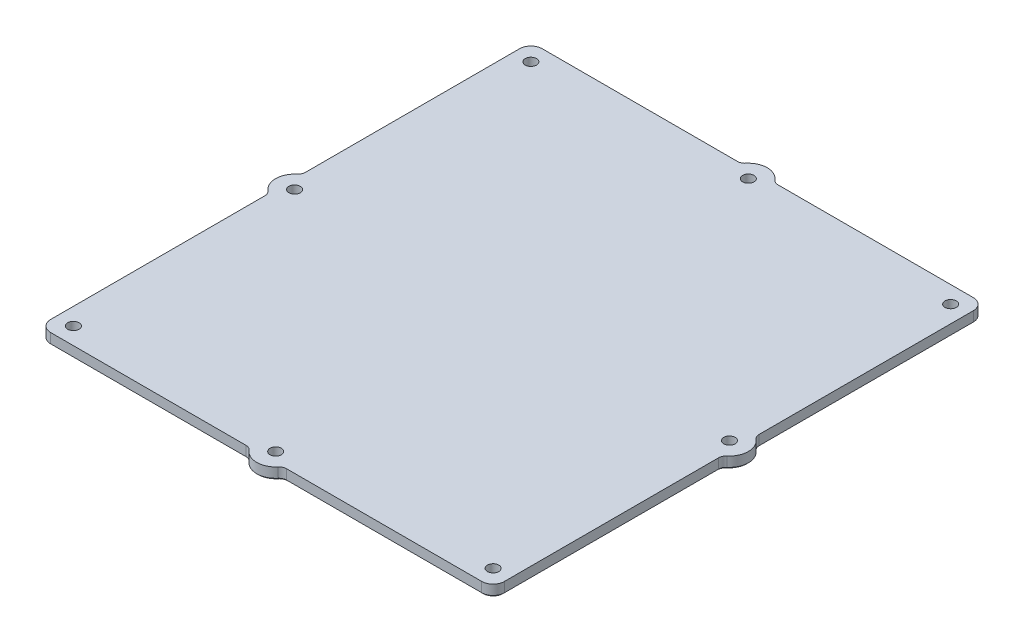
from build123d import *

# Parameters (mm, degrees)
SKETCH_1_W              = 120
SKETCH_1_H              = 130
EXTRUDE_1_DEPTH         = 3
SKETCH_2_R              = 1.5
CUT_EXTRUDE_1_DEPTH     = 3
FILLET_1_R              = 3
SKETCH_4_R              = 1.5
CUT_EXTRUDE_3_DEPTH     = 177.943493805
EXTRUDE_2_DEPTH         = 3
FILLET_2_R              = 2
CHAMFER_1_SIZE          = 0.4
CUT_EXTRUDE_START       = -0.4
CUT_EXTRUDE_4_OUTLINE_W = 2.081871345
CUT_EXTRUDE_4_OUTLINE_H = 12.109161793
CUT_EXTRUDE_4_DEPTH     = 0.4


# Read off the part's stored shape, not the designer's step: 切除-拉伸4
with BuildPart() as part:
    # 草图1 → 凸台-拉伸1 (new body)
    with BuildSketch(Plane(origin=(0, 0, 0), x_dir=(1, 0, 0), z_dir=(0, 1, 0))):
        with Locations((60, 65)):
            Rectangle(SKETCH_1_W, SKETCH_1_H)
    extrude(amount=EXTRUDE_1_DEPTH)

    # 草图2 → 切除-拉伸1 (cut)
    with BuildSketch(Plane(origin=(0, 3, 0), x_dir=(1, 0, 0), z_dir=(0, 1, 0))):
        with Locations(Location((4.5, 125.5, 0), (0, 0, 270))):
            Circle(SKETCH_2_R)
        with Locations(Location((115.5, 125.5, 0), (0, 0, 270))):
            Circle(SKETCH_2_R)
        with Locations(Location((115.5, 4.5, 0), (0, 0, 270))):
            Circle(SKETCH_2_R)
        with Locations(Location((4.5, 4.5, 0), (0, 0, 270))):
            Circle(SKETCH_2_R)
    extrude(amount=-CUT_EXTRUDE_1_DEPTH, mode=Mode.SUBTRACT)

    # 圆角1
    fillet_1_edges = [part.edges().sort_by_distance(p)[0] for p in [
        (0, 1.5, -130),
        (120, 1.5, -130),
        (120, 1.5, 0),
        (0, 1.5, 0),
    ]]
    fillet(fillet_1_edges, radius=FILLET_1_R)

    # 草图4 → 切除-拉伸3 (cut, through all)
    with BuildSketch(Plane(origin=(0, 0, 0), x_dir=(-1, 0, 0), z_dir=(0, -1, 0))):
        with Locations(Location((-117.5, 65, 0), (0, 0, 90))):
            Circle(SKETCH_4_R)
        with Locations(Location((-60, 127.5, 0), (0, 0, 90))):
            Circle(SKETCH_4_R)
        with Locations(Location((-2.5, 65, 0), (0, 0, 90))):
            Circle(SKETCH_4_R)
        with Locations(Location((-60, 2.5, 0), (0, 0, 90))):
            Circle(SKETCH_4_R)
    extrude(amount=-CUT_EXTRUDE_3_DEPTH, mode=Mode.SUBTRACT)

    # 草图6 → 凸台-拉伸2 (add)
    with BuildSketch(Plane(origin=(0, 0, 0), x_dir=(-1, 0, 0), z_dir=(0, -1, 0))):
        with BuildLine():
            Line((-55.669872981, 0), (-64.330127019, 0))
            ThreePointArc((-64.330127019, 0), (-60, -2.5), (-55.669872981, 0))
        make_face()
        with BuildLine():
            Line((0, 60.669872981), (0, 69.330127019))
            ThreePointArc((0, 69.330127019), (2.5, 65), (0, 60.669872981))
        make_face()
        with BuildLine():
            Line((-55.669872981, 130), (-64.330127019, 130))
            ThreePointArc((-64.330127019, 130), (-60, 132.5), (-55.669872981, 130))
        make_face()
        with BuildLine():
            Line((-120, 60.669872981), (-120, 69.330127019))
            ThreePointArc((-120, 69.330127019), (-122.5, 65), (-120, 60.669872981))
        make_face()
    extrude(amount=-EXTRUDE_2_DEPTH)

    # 圆角2
    fillet_2_edges = [part.edges().sort_by_distance(p)[0] for p in [
        (120, 1.5, -60.669872981),
        (120, 1.5, -69.330127019),
        (55.669872981, 1.5, 0),
        (64.330127019, 1.5, 0),
        (64.330127019, 1.5, -130),
        (55.669872981, 1.5, -130),
        (0, 1.5, -69.330127019),
        (0, 1.5, -60.669872981),
    ]]
    fillet(fillet_2_edges, radius=FILLET_2_R)

    # 倒角1
    chamfer_1_edges = [part.edges().sort_by_distance(p)[0] for p in [
        (120, 0, -98.680951324),
        (122.5, 0, -65),
        (91.180951324, 0, 0),
        (60, 0, 2.5),
        (-2.5, 0, -65),
        (28.819048676, 0, -130),
        (60, 0, -132.5),
        (0, 0, -31.319048676),
        (120.187346066, 0, -69.516748393),
        (120.187346066, 0, -60.483251607),
        (64.516748393, 0, 0.187346066),
        (55.483251607, 0, 0.187346066),
        (-0.187346066, 0, -69.516748393),
        (55.483251607, 0, -130.187346066),
        (64.516748393, 0, -130.187346066),
        (-0.187346066, 0, -60.483251607),
        (4.5, 0, -6),
        (115.5, 0, -6),
        (115.5, 0, -127),
        (4.5, 0, -127),
        (0, 0, -98.680951324),
        (91.180951324, 0, -130),
        (120, 0, -31.319048676),
        (28.819048676, 0, 0),
        (0.878679656, 0, -0.878679656),
        (119.121320344, 0, -0.878679656),
        (119.121320344, 0, -129.121320344),
        (0.878679656, 0, -129.121320344),
        (117.5, 0, -63.5),
        (60, 0, -126),
        (2.5, 0, -63.5),
        (60, 0, -1),
    ]]
    chamfer(chamfer_1_edges, length=CHAMFER_1_SIZE)

    # 切除-拉伸4 outline → 切除-拉伸4 (cut)
    # profile 1 of 9: a face of its own
    with BuildSketch(Plane(origin=(0, 0, 0), x_dir=(-1, 0, 0), z_dir=(0, -1, 0)).offset(CUT_EXTRUDE_START)):
        with BuildLine():
            add(Edge.make_bspline(
                [(-93.842597619, 70.642021665), (-93.621504559, 70.63755981), (-93.192959468, 70.628911388), (-92.572802476, 70.561692302), (-91.998556709, 70.448204443), (-91.470334132, 70.290461994), (-90.987295697, 70.087463663), (-90.549684034, 69.83753463), (-90.159300203, 69.539039504), (-89.814297782, 69.193703423), (-89.511835456, 68.7993463), (-89.255278497, 68.349235957), (-89.034115776, 67.848793836), (-88.854987072, 67.292990542), (-88.719890276, 66.683553056), (-88.622348209, 66.020814756), (-88.562292192, 65.304592968), (-88.5547524, 64.808918818), (-88.55084973, 64.552353049)],
                knots=[0, 0, 0, 0, 0.071201178, 0.138009377, 0.200615386, 0.259496855, 0.315264295, 0.369016079, 0.421367624, 0.473064341, 0.525807093, 0.580944039, 0.639536507, 0.701748872, 0.768699696, 0.840366328, 0.917372057, 1, 1, 1, 1], degree=3))
            Line((-93.842597619, 70.642021665), (-96.350719776, 70.642021665))
            Line((-96.350719776, 70.642021665), (-96.350719776, 58.532859872))
            Line((-96.350719776, 58.532859872), (-93.842597619, 58.532859872))
            add(Edge.make_bspline(
                [(-88.55084973, 64.552353049), (-88.555570498, 64.29578876), (-88.564693164, 63.799989997), (-88.627829381, 63.083814876), (-88.740073451, 62.423746086), (-88.890415923, 61.81693293), (-89.090708302, 61.265346897), (-89.334761121, 60.76876052), (-89.621770574, 60.325577948), (-89.957274109, 59.940996965), (-90.333787716, 59.610966979), (-90.736796903, 59.319357305), (-91.175990614, 59.077430131), (-91.645251045, 58.875071981), (-92.150072931, 58.724281219), (-92.685235098, 58.61098466), (-93.253658531, 58.54705882), (-93.643180915, 58.537667682), (-93.842597619, 58.532859872)],
                knots=[0, 0, 0, 0, 0.083884036, 0.162102066, 0.234794836, 0.302603191, 0.366226687, 0.426272698, 0.483153898, 0.538366567, 0.592541318, 0.646543992, 0.700689114, 0.756145388, 0.813312224, 0.87264444, 0.934800086, 1, 1, 1, 1], degree=3))
        make_face()
        with BuildLine():
            add(Edge.make_bspline(
                [(-93.842597619, 60.172885863), (-93.71509612, 60.175834067), (-93.467954965, 60.181548687), (-93.10966435, 60.226901781), (-92.775425943, 60.29757872), (-92.467082035, 60.402363426), (-92.182705821, 60.53512808), (-91.924140853, 60.7004657), (-91.688603192, 60.893385854), (-91.476444353, 61.118335282), (-91.288450659, 61.382730215), (-91.131259096, 61.695355757), (-91.000378403, 62.055534905), (-90.888432626, 62.461994563), (-90.804571318, 62.917731967), (-90.746734239, 63.420522825), (-90.710058234, 63.970483396), (-90.705349837, 64.353027415), (-90.702896514, 64.552353049)],
                knots=[0, 0, 0, 0, 0.06157925, 0.119361476, 0.17420375, 0.226354123, 0.276345084, 0.325461037, 0.374229775, 0.423086444, 0.474419126, 0.530390201, 0.591577019, 0.659307146, 0.733845725, 0.815199008, 0.903708925, 1, 1, 1, 1], degree=3))
            Line((-93.842597619, 60.172885863), (-94.268848431, 60.172885863))
            Line((-94.268848431, 60.172885863), (-94.268848431, 69.001995674))
            Line((-94.268848431, 69.001995674), (-93.842597619, 69.001995674))
            add(Edge.make_bspline(
                [(-90.702896514, 64.552353049), (-90.705347471, 64.752545717), (-90.710052163, 65.136822052), (-90.746777665, 65.689364788), (-90.804472492, 66.19478917), (-90.888974246, 66.653794512), (-91.00018179, 67.065938032), (-91.133778496, 67.431501716), (-91.291688296, 67.750720834), (-91.478764144, 68.02259829), (-91.690985772, 68.254183254), (-91.923256484, 68.457026582), (-92.183203957, 68.626981349), (-92.468281661, 68.764663227), (-92.777147992, 68.871639864), (-93.11031926, 68.945644269), (-93.467784438, 68.993987446), (-93.715075462, 68.999271046), (-93.842597619, 69.001995674)],
                knots=[0, 0, 0, 0, 0.095937682, 0.184155499, 0.265271805, 0.339623548, 0.407614047, 0.469624787, 0.525889424, 0.577833102, 0.627214304, 0.676079586, 0.725254369, 0.775579675, 0.82744862, 0.881538554, 0.938912222, 1, 1, 1, 1], degree=3))
        make_face(mode=Mode.SUBTRACT)
    # profile 2 of 9: a face of its own
    with BuildSketch(Plane(origin=(0, 0, 0), x_dir=(-1, 0, 0), z_dir=(0, -1, 0)).offset(CUT_EXTRUDE_START)):
        with BuildLine():
            add(Edge.make_bspline(
                [(-102.991395539, 70.642021665), (-102.77030248, 70.63755981), (-102.341757389, 70.628911388), (-101.721600396, 70.561692302), (-101.147354629, 70.448204443), (-100.619132053, 70.290461994), (-100.136093618, 70.087463663), (-99.698481955, 69.83753463), (-99.308098124, 69.539039504), (-98.963095703, 69.193703423), (-98.660633376, 68.7993463), (-98.404076418, 68.349235957), (-98.182913697, 67.848793836), (-98.003784993, 67.292990542), (-97.868688197, 66.683553056), (-97.77114613, 66.020814756), (-97.711090112, 65.304592968), (-97.703550321, 64.808918818), (-97.699647651, 64.552353049)],
                knots=[0, 0, 0, 0, 0.071201178, 0.138009377, 0.200615386, 0.259496855, 0.315264295, 0.369016079, 0.421367624, 0.473064341, 0.525807093, 0.580944039, 0.639536507, 0.701748872, 0.768699696, 0.840366328, 0.917372057, 1, 1, 1, 1], degree=3))
            Line((-102.991395539, 70.642021665), (-105.499517697, 70.642021665))
            Line((-105.499517697, 70.642021665), (-105.499517697, 58.532859872))
            Line((-105.499517697, 58.532859872), (-102.991395539, 58.532859872))
            add(Edge.make_bspline(
                [(-97.699647651, 64.552353049), (-97.704368418, 64.29578876), (-97.713491085, 63.799989997), (-97.776627302, 63.083814876), (-97.888871371, 62.423746086), (-98.039213843, 61.81693293), (-98.239506223, 61.265346897), (-98.483559042, 60.76876052), (-98.770568495, 60.325577948), (-99.10607203, 59.940996965), (-99.482585637, 59.610966979), (-99.885594824, 59.319357305), (-100.324788534, 59.077430131), (-100.794048966, 58.875071981), (-101.298870852, 58.724281219), (-101.834033018, 58.61098466), (-102.402456451, 58.54705882), (-102.791978836, 58.537667682), (-102.991395539, 58.532859872)],
                knots=[0, 0, 0, 0, 0.083884036, 0.162102066, 0.234794836, 0.302603191, 0.366226687, 0.426272698, 0.483153898, 0.538366567, 0.592541318, 0.646543992, 0.700689114, 0.756145388, 0.813312224, 0.87264444, 0.934800086, 1, 1, 1, 1], degree=3))
        make_face()
        with BuildLine():
            add(Edge.make_bspline(
                [(-102.991395539, 60.172885863), (-102.863894041, 60.175834067), (-102.616752886, 60.181548687), (-102.258462271, 60.226901781), (-101.924223864, 60.29757872), (-101.615879956, 60.402363426), (-101.331503742, 60.53512808), (-101.072938774, 60.7004657), (-100.837401112, 60.893385854), (-100.625242273, 61.118335282), (-100.437248579, 61.382730215), (-100.280057017, 61.695355757), (-100.149176324, 62.055534905), (-100.037230546, 62.461994563), (-99.953369239, 62.917731967), (-99.89553216, 63.420522825), (-99.858856155, 63.970483396), (-99.854147758, 64.353027415), (-99.851694435, 64.552353049)],
                knots=[0, 0, 0, 0, 0.06157925, 0.119361476, 0.17420375, 0.226354123, 0.276345084, 0.325461037, 0.374229775, 0.423086444, 0.474419126, 0.530390201, 0.591577019, 0.659307146, 0.733845725, 0.815199008, 0.903708925, 1, 1, 1, 1], degree=3))
            Line((-102.991395539, 60.172885863), (-103.417646352, 60.172885863))
            Line((-103.417646352, 60.172885863), (-103.417646352, 69.001995674))
            Line((-103.417646352, 69.001995674), (-102.991395539, 69.001995674))
            add(Edge.make_bspline(
                [(-99.851694435, 64.552353049), (-99.854145392, 64.752545717), (-99.858850084, 65.136822052), (-99.895575585, 65.689364788), (-99.953270413, 66.19478917), (-100.037772167, 66.653794512), (-100.14897971, 67.065938032), (-100.282576416, 67.431501716), (-100.440486216, 67.750720834), (-100.627562065, 68.02259829), (-100.839783693, 68.254183254), (-101.072054405, 68.457026582), (-101.332001878, 68.626981349), (-101.617079582, 68.764663227), (-101.925945913, 68.871639864), (-102.25911718, 68.945644269), (-102.616582358, 68.993987446), (-102.863873382, 68.999271046), (-102.991395539, 69.001995674)],
                knots=[0, 0, 0, 0, 0.095937682, 0.184155499, 0.265271805, 0.339623548, 0.407614047, 0.469624787, 0.525889424, 0.577833102, 0.627214304, 0.676079586, 0.725254369, 0.775579675, 0.82744862, 0.881538554, 0.938912222, 1, 1, 1, 1], degree=3))
        make_face(mode=Mode.SUBTRACT)
    # profile 3 of 9: a face of its own
    with BuildSketch(Plane(origin=(0, 0, 0), x_dir=(-1, 0, 0), z_dir=(0, -1, 0)).offset(CUT_EXTRUDE_START)):
        Polygon((-15.017386443, 58.532859872), (-18.942012823, 65.857096389), (-15.292890016, 70.642021665), (-17.567094045, 70.642021665), (-21.078465065, 65.545205551), (-21.078465065, 70.642021665), (-23.16033641, 70.642021665), (-23.16033641, 58.532859872), (-21.078465065, 58.532859872), (-21.078465065, 63.099461561), (-20.280544337, 64.386011269), (-17.242207755, 58.532859872), align=None)
    # profile 4 of 9: a face of its own
    with BuildSketch(Plane(origin=(0, 0, 0), x_dir=(-1, 0, 0), z_dir=(0, -1, 0)).offset(CUT_EXTRUDE_START)):
        Polygon((-26.879634656, 58.532859872), (-24.717191511, 58.532859872), (-24.717191511, 70.642021665), (-26.799062856, 70.642021665), (-26.799062856, 62.898612709), (-30.232461166, 70.642021665), (-32.379309769, 70.642021665), (-32.379309769, 58.532859872), (-30.294839334, 58.532859872), (-30.294839334, 66.229953543), align=None)
    # profile 5 of 9: a face of its own
    with BuildSketch(Plane(origin=(0, 0, 0), x_dir=(-1, 0, 0), z_dir=(0, -1, 0)).offset(CUT_EXTRUDE_START)):
        with Locations((-37.661960842, 64.587440769)):
            Rectangle(CUT_EXTRUDE_4_OUTLINE_W, CUT_EXTRUDE_4_OUTLINE_H)
    # profile 6 of 9: a face of its own
    with BuildSketch(Plane(origin=(0, 0, 0), x_dir=(-1, 0, 0), z_dir=(0, -1, 0)).offset(CUT_EXTRUDE_START)):
        Polygon((-50.539153824, 58.532859872), (-42.877035565, 58.532859872), (-42.877035565, 60.172885863), (-48.454683389, 60.172885863), (-48.454683389, 70.642021665), (-50.539153824, 70.642021665), align=None)
    # profile 7 of 9: a face of its own
    with BuildSketch(Plane(origin=(0, 0, 0), x_dir=(-1, 0, 0), z_dir=(0, -1, 0)).offset(CUT_EXTRUDE_START)):
        Polygon((-62.806860127, 58.532859872), (-60.691200608, 58.532859872), (-64.186977086, 70.779773452), (-65.969953044, 70.779773452), (-69.455333161, 58.532859872), (-67.350070003, 58.532859872), (-66.385807495, 62.181982679), (-63.771122635, 62.181982679), align=None)
        Polygon((-64.153188912, 63.82460776), (-65.995943947, 63.82460776), (-65.079082986, 67.184925766), align=None, mode=Mode.SUBTRACT)
    # profile 8 of 9: a face of its own
    with BuildSketch(Plane(origin=(0, 0, 0), x_dir=(-1, 0, 0), z_dir=(0, -1, 0)).offset(CUT_EXTRUDE_START)):
        Polygon((-75.298088197, 58.532859872), (-73.216216852, 58.532859872), (-73.216216852, 69.001995674), (-70.461181114, 69.001995674), (-70.461181114, 70.642021665), (-78.053123934, 70.642021665), (-78.053123934, 69.001995674), (-75.298088197, 69.001995674), align=None)
    # profile 9 of 9: a face of its own
    with BuildSketch(Plane(origin=(0, 0, 0), x_dir=(-1, 0, 0), z_dir=(0, -1, 0)).offset(CUT_EXTRUDE_START)):
        Polygon((-81.104455968, 58.532859872), (-78.988796449, 58.532859872), (-82.484572927, 70.779773452), (-84.267548886, 70.779773452), (-87.752929003, 58.532859872), (-85.647665845, 58.532859872), (-84.683403337, 62.181982679), (-82.068718476, 62.181982679), align=None)
        Polygon((-82.450784753, 63.82460776), (-84.293539789, 63.82460776), (-83.376678827, 67.184925766), align=None, mode=Mode.SUBTRACT)
    extrude(amount=CUT_EXTRUDE_4_DEPTH, mode=Mode.SUBTRACT)


solid = part.part
